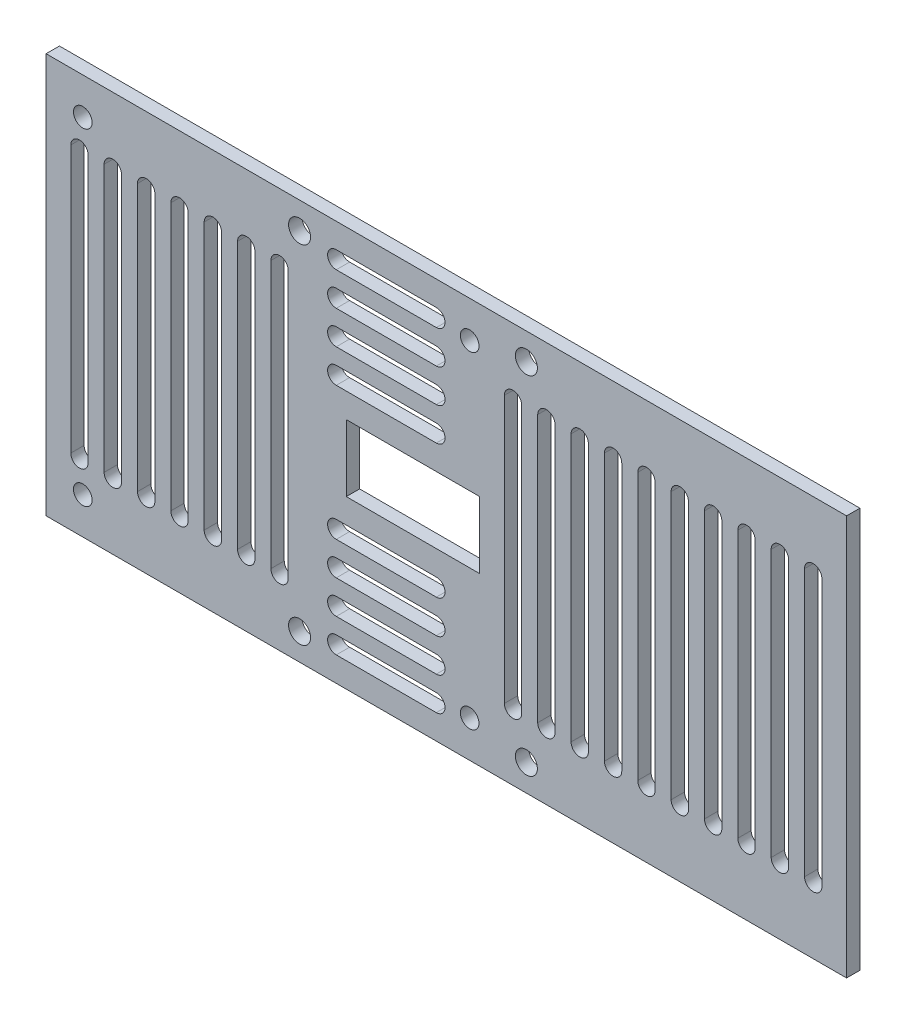
from build123d import *

# Parameters (mm, degrees)
SKETCH_4_R          = 1.4
SKETCH_4_R_2        = 1.65
SKETCH_4_W          = 20
SKETCH_4_H          = 10
EXTRUDE_2_DEPTH     = 2
CUT_EXTRUDE_1_DEPTH = 72.617037079


with BuildPart() as part:
    # 草图4 → 凸台-拉伸2 (new body)
    with BuildSketch(Plane.XY):
        Polygon((-39, 30), (39, 30), (55, 30), (65, 30), (65, -30), (39, -30), (-39, -30), (-55, -30), (-55, -14), (-55, 14), (-55, 30), align=None)
        with Locations((-49.5, 24.5)):
            Circle(SKETCH_4_R, mode=Mode.SUBTRACT)
        with Locations((8.5, 24.5)):
            Circle(SKETCH_4_R, mode=Mode.SUBTRACT)
        with Locations((17, 26)):
            Circle(SKETCH_4_R_2, mode=Mode.SUBTRACT)
        with Locations((-17, 26)):
            Circle(SKETCH_4_R_2, mode=Mode.SUBTRACT)
        with Locations((-17, -26)):
            Circle(SKETCH_4_R_2, mode=Mode.SUBTRACT)
        with Locations((17, -26)):
            Circle(SKETCH_4_R_2, mode=Mode.SUBTRACT)
        with Locations((8.5, -24.5)):
            Circle(SKETCH_4_R, mode=Mode.SUBTRACT)
        with Locations((-49.5, -24.5)):
            Circle(SKETCH_4_R, mode=Mode.SUBTRACT)
        Rectangle(SKETCH_4_W, SKETCH_4_H, mode=Mode.SUBTRACT)
    extrude(amount=EXTRUDE_2_DEPTH)

    # 草图5 → 切除-拉伸1 (cut, through all)
    with BuildSketch(Plane.XY.offset(2)):
        with BuildLine():
            Line((-48.7, 20), (-48.7, -20))
            ThreePointArc((-48.7, -20), (-50, -21.3), (-51.3, -20))
            Line((-51.3, -20), (-51.3, 20))
            ThreePointArc((-51.3, 20), (-50, 21.3), (-48.7, 20))
        make_face()
        with BuildLine():
            Line((-11.5, 26.3), (3.5, 26.3))
            ThreePointArc((3.5, 26.3), (4.8, 25), (3.5, 23.7))
            Line((3.5, 23.7), (-11.5, 23.7))
            ThreePointArc((-11.5, 23.7), (-12.8, 25), (-11.5, 26.3))
        make_face()
        with BuildLine():
            Line((-43.7, 20), (-43.7, -20))
            ThreePointArc((-43.7, -20), (-45, -21.3), (-46.3, -20))
            Line((-46.3, -20), (-46.3, 20))
            ThreePointArc((-46.3, 20), (-45, 21.3), (-43.7, 20))
        make_face()
        with BuildLine():
            Line((-38.7, 20), (-38.7, -20))
            ThreePointArc((-38.7, -20), (-40, -21.3), (-41.3, -20))
            Line((-41.3, -20), (-41.3, 20))
            ThreePointArc((-41.3, 20), (-40, 21.3), (-38.7, 20))
        make_face()
        with BuildLine():
            Line((-33.7, 20), (-33.7, -20))
            ThreePointArc((-33.7, -20), (-35, -21.3), (-36.3, -20))
            Line((-36.3, -20), (-36.3, 20))
            ThreePointArc((-36.3, 20), (-35, 21.3), (-33.7, 20))
        make_face()
        with BuildLine():
            Line((-28.7, 20), (-28.7, -20))
            ThreePointArc((-28.7, -20), (-30, -21.3), (-31.3, -20))
            Line((-31.3, -20), (-31.3, 20))
            ThreePointArc((-31.3, 20), (-30, 21.3), (-28.7, 20))
        make_face()
        with BuildLine():
            Line((-23.7, 20), (-23.7, -20))
            ThreePointArc((-23.7, -20), (-25, -21.3), (-26.3, -20))
            Line((-26.3, -20), (-26.3, 20))
            ThreePointArc((-26.3, 20), (-25, 21.3), (-23.7, 20))
        make_face()
        with BuildLine():
            Line((-18.7, 20), (-18.7, -20))
            ThreePointArc((-18.7, -20), (-20, -21.3), (-21.3, -20))
            Line((-21.3, -20), (-21.3, 20))
            ThreePointArc((-21.3, 20), (-20, 21.3), (-18.7, 20))
        make_face()
        with BuildLine():
            Line((16.3, 20), (16.3, -20))
            ThreePointArc((16.3, -20), (15, -21.3), (13.7, -20))
            Line((13.7, -20), (13.7, 20))
            ThreePointArc((13.7, 20), (15, 21.3), (16.3, 20))
        make_face()
        with BuildLine():
            Line((21.3, 20), (21.3, -20))
            ThreePointArc((21.3, -20), (20, -21.3), (18.7, -20))
            Line((18.7, -20), (18.7, 20))
            ThreePointArc((18.7, 20), (20, 21.3), (21.3, 20))
        make_face()
        with BuildLine():
            Line((26.3, 20), (26.3, -20))
            ThreePointArc((26.3, -20), (25, -21.3), (23.7, -20))
            Line((23.7, -20), (23.7, 20))
            ThreePointArc((23.7, 20), (25, 21.3), (26.3, 20))
        make_face()
        with BuildLine():
            Line((31.3, 20), (31.3, -20))
            ThreePointArc((31.3, -20), (30, -21.3), (28.7, -20))
            Line((28.7, -20), (28.7, 20))
            ThreePointArc((28.7, 20), (30, 21.3), (31.3, 20))
        make_face()
        with BuildLine():
            Line((36.3, 20), (36.3, -20))
            ThreePointArc((36.3, -20), (35, -21.3), (33.7, -20))
            Line((33.7, -20), (33.7, 20))
            ThreePointArc((33.7, 20), (35, 21.3), (36.3, 20))
        make_face()
        with BuildLine():
            Line((41.3, 20), (41.3, -20))
            ThreePointArc((41.3, -20), (40, -21.3), (38.7, -20))
            Line((38.7, -20), (38.7, 20))
            ThreePointArc((38.7, 20), (40, 21.3), (41.3, 20))
        make_face()
        with BuildLine():
            Line((46.3, 20), (46.3, -20))
            ThreePointArc((46.3, -20), (45, -21.3), (43.7, -20))
            Line((43.7, -20), (43.7, 20))
            ThreePointArc((43.7, 20), (45, 21.3), (46.3, 20))
        make_face()
        with BuildLine():
            Line((51.3, 20), (51.3, -20))
            ThreePointArc((51.3, -20), (50, -21.3), (48.7, -20))
            Line((48.7, -20), (48.7, 20))
            ThreePointArc((48.7, 20), (50, 21.3), (51.3, 20))
        make_face()
        with BuildLine():
            Line((56.3, 20), (56.3, -20))
            ThreePointArc((56.3, -20), (55, -21.3), (53.7, -20))
            Line((53.7, -20), (53.7, 20))
            ThreePointArc((53.7, 20), (55, 21.3), (56.3, 20))
        make_face()
        with BuildLine():
            Line((61.3, 20), (61.3, -20))
            ThreePointArc((61.3, -20), (60, -21.3), (58.7, -20))
            Line((58.7, -20), (58.7, 20))
            ThreePointArc((58.7, 20), (60, 21.3), (61.3, 20))
        make_face()
        with BuildLine():
            Line((-11.5, 21.3), (3.5, 21.3))
            ThreePointArc((3.5, 21.3), (4.8, 20), (3.5, 18.7))
            Line((3.5, 18.7), (-11.5, 18.7))
            ThreePointArc((-11.5, 18.7), (-12.8, 20), (-11.5, 21.3))
        make_face()
        with BuildLine():
            Line((-11.5, 16.3), (3.5, 16.3))
            ThreePointArc((3.5, 16.3), (4.8, 15), (3.5, 13.7))
            Line((3.5, 13.7), (-11.5, 13.7))
            ThreePointArc((-11.5, 13.7), (-12.8, 15), (-11.5, 16.3))
        make_face()
        with BuildLine():
            Line((-11.5, 11.3), (3.5, 11.3))
            ThreePointArc((3.5, 11.3), (4.8, 10), (3.5, 8.7))
            Line((3.5, 8.7), (-11.5, 8.7))
            ThreePointArc((-11.5, 8.7), (-12.8, 10), (-11.5, 11.3))
        make_face()
        with BuildLine():
            Line((-11.5, -8.7), (3.5, -8.7))
            ThreePointArc((3.5, -8.7), (4.8, -10), (3.5, -11.3))
            Line((3.5, -11.3), (-11.5, -11.3))
            ThreePointArc((-11.5, -11.3), (-12.8, -10), (-11.5, -8.7))
        make_face()
        with BuildLine():
            Line((-11.5, -13.7), (3.5, -13.7))
            ThreePointArc((3.5, -13.7), (4.8, -15), (3.5, -16.3))
            Line((3.5, -16.3), (-11.5, -16.3))
            ThreePointArc((-11.5, -16.3), (-12.8, -15), (-11.5, -13.7))
        make_face()
        with BuildLine():
            Line((-11.5, -18.7), (3.5, -18.7))
            ThreePointArc((3.5, -18.7), (4.8, -20), (3.5, -21.3))
            Line((3.5, -21.3), (-11.5, -21.3))
            ThreePointArc((-11.5, -21.3), (-12.8, -20), (-11.5, -18.7))
        make_face()
        with BuildLine():
            Line((-11.5, -23.7), (3.5, -23.7))
            ThreePointArc((3.5, -23.7), (4.8, -25), (3.5, -26.3))
            Line((3.5, -26.3), (-11.5, -26.3))
            ThreePointArc((-11.5, -26.3), (-12.8, -25), (-11.5, -23.7))
        make_face()
    extrude(amount=-CUT_EXTRUDE_1_DEPTH, mode=Mode.SUBTRACT)


solid = part.part
